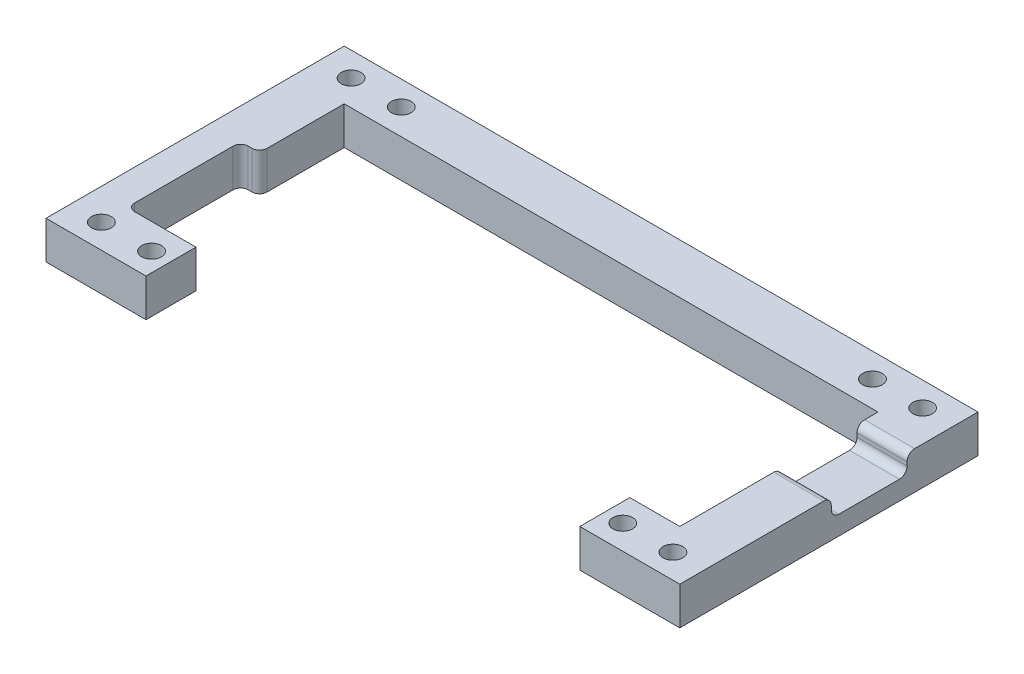
from build123d import *

# Parameters (mm, degrees)
SKETCH1_R           = 1.651
BOSS_EXTRUDE1_DEPTH = 6.35
SKETCH2_W           = 12.7
SKETCH2_H           = 3.175
CUT_EXTRUDE7_DEPTH  = 8.89
FILLET2_R           = 1.27
SKETCH4_W           = 3.175
SKETCH4_H           = 19.05
CUT_EXTRUDE8_DEPTH  = 192.82600491
FILLET3_R           = 1.27
SKETCH5_R           = 2.8575
SKETCH5_R_2         = 3.175
CUT_EXTRUDE9_DEPTH  = 2.54


with BuildPart() as part:
    # Sketch1 → Boss-Extrude1 (new body)
    with BuildSketch(Plane(origin=(0, 0, 0), x_dir=(1, 0, 0), z_dir=(0, 1, 0))):
        Polygon((75.155177047, 61.997896552), (75.155177047, 11.997896552), (91.919177047, 11.997896552), (91.919177047, 20.379896552), (83.537177047, 20.379896552), (83.537177047, 53.615896552), (173.037829354, 53.615896552), (173.037829354, 20.379896552), (164.655829354, 20.379896552), (164.655829354, 11.997896552), (181.419829354, 11.997896552), (181.419829354, 61.997896552), align=None)
        with Locations((80.3721812, 16.064784874)):
            Circle(SKETCH1_R, mode=Mode.SUBTRACT)
        with Locations((80.3721812, 57.93100823)):
            Circle(SKETCH1_R, mode=Mode.SUBTRACT)
        with Locations((167.7875512, 57.93100823)):
            Circle(SKETCH1_R, mode=Mode.SUBTRACT)
        with Locations((88.7874552, 57.93100823)):
            Circle(SKETCH1_R, mode=Mode.SUBTRACT)
        with Locations((88.7874552, 16.064784874)):
            Circle(SKETCH1_R, mode=Mode.SUBTRACT)
        with Locations((176.2028252, 57.93100823)):
            Circle(SKETCH1_R, mode=Mode.SUBTRACT)
        with Locations((176.2028252, 16.064784874)):
            Circle(SKETCH1_R, mode=Mode.SUBTRACT)
        with Locations((167.7875512, 16.064784874)):
            Circle(SKETCH1_R, mode=Mode.SUBTRACT)
    extrude(amount=BOSS_EXTRUDE1_DEPTH)

    # Sketch2 → Cut-Extrude7 (cut)
    with BuildSketch(Plane(origin=(181.419829354, 0, 0), x_dir=(0, 0, -1), z_dir=(1, 0, 0))):
        with Locations((43.747896552, 4.7625)):
            Rectangle(SKETCH2_W, SKETCH2_H)
    extrude(amount=-CUT_EXTRUDE7_DEPTH, mode=Mode.SUBTRACT)

    # Fillet2
    fillet2_edges = [part.edges().sort_by_distance(p)[0] for p in [
        (177.228829354, 3.175, -37.397896552),
        (177.228829354, 6.35, -37.397896552),
        (177.228829354, 6.35, -50.097896552),
        (177.228829354, 3.175, -50.097896552),
    ]]
    fillet(fillet2_edges, radius=FILLET2_R)

    # Sketch4 → Cut-Extrude8 (cut, through all)
    with BuildSketch(Plane(origin=(0, 6.35, 0), x_dir=(1, 0, 0), z_dir=(0, 1, 0))):
        with Locations((81.949677047, 29.904896552)):
            Rectangle(SKETCH4_W, SKETCH4_H)
    extrude(amount=-CUT_EXTRUDE8_DEPTH, mode=Mode.SUBTRACT)

    # Fillet3
    fillet3_edges = [part.edges().sort_by_distance(p)[0] for p in [
        (80.362177047, 3.175, -20.379896552),
        (80.362177047, 3.175, -39.429896552),
        (83.537177047, 3.175, -39.429896552),
    ]]
    fillet(fillet3_edges, radius=FILLET3_R)

    # Sketch5 → Cut-Extrude9 (cut)
    with BuildSketch(Plane.XZ):
        with Locations((88.7874552, -16.064784874)):
            Circle(SKETCH5_R)
        with Locations((88.7874552, -57.93100823)):
            Circle(SKETCH5_R_2)
        with Locations((167.7875512, -57.93100823)):
            Circle(SKETCH5_R_2)
        with Locations((167.7875512, -16.064784874)):
            Circle(SKETCH5_R)
    extrude(amount=-CUT_EXTRUDE9_DEPTH, mode=Mode.SUBTRACT)


solid = part.part
